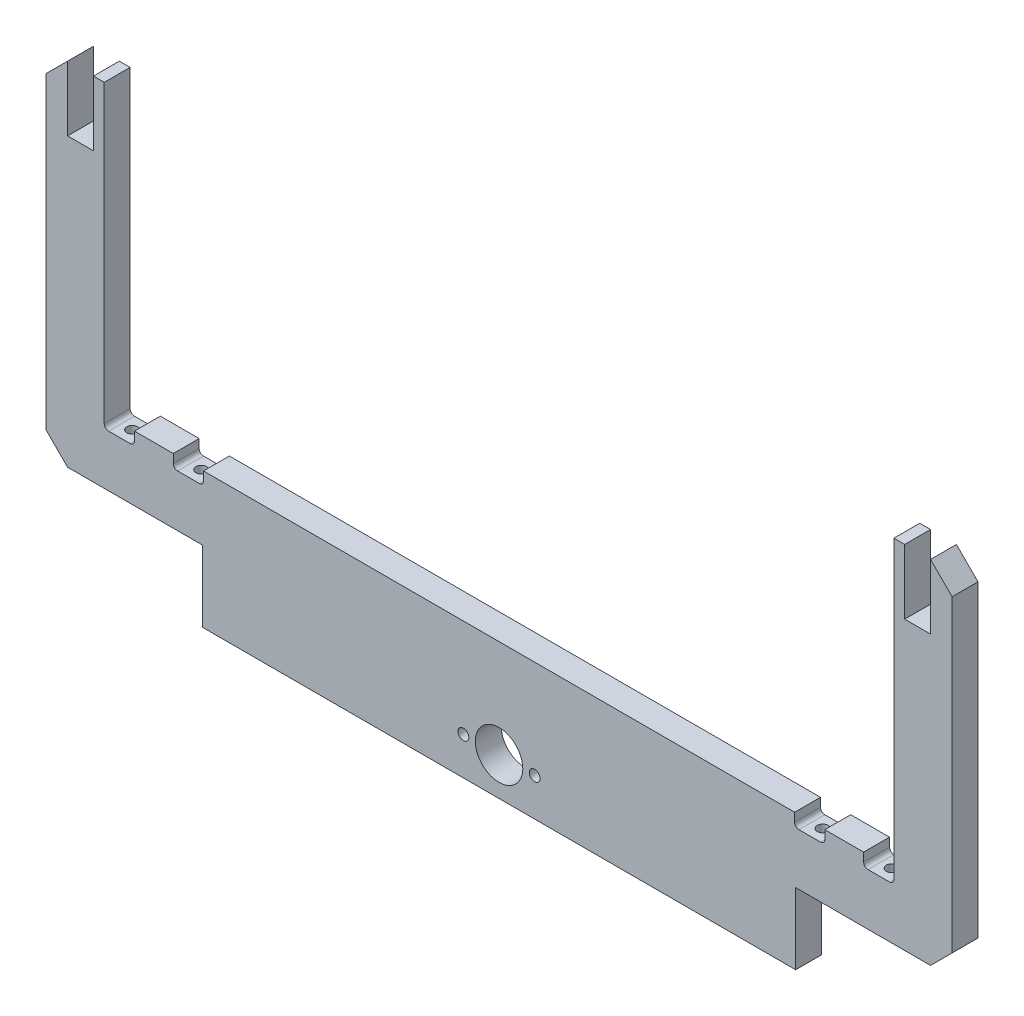
from build123d import *

# Parameters (mm, degrees)
SKETCH1_W            = 275
SKETCH1_H            = 33
BOSS_EXTRUDE1_DEPTH  = 12
CUT_EXTRUDE1_REACH   = 141.005
SKETCH2_R            = 11
SKETCH2_R_2          = 2.5
BOSS_EXTRUDE2_DEPTH  = 12
CUT_EXTRUDE2_REACH   = 250.863
SKETCH4_R            = 2.5
CUT_EXTRUDE3_REACH   = 278.522
SKETCH5_W            = 14
SKETCH5_H            = 6
FILLET1_R            = 2
FILLET1_OF_MIRROR2_R = 2
CHAMFER1_SIZE        = 10
CUT_EXTRUDE4_REACH   = 278.522
SKETCH6_W            = 12
SKETCH6_H            = 30
CHAMFER2_SIZE        = 10


with BuildPart() as part:
    # Sketch1 → Boss-Extrude1 (new body)
    with BuildSketch(Plane.XY):
        Rectangle(SKETCH1_W, SKETCH1_H)
    extrude(amount=BOSS_EXTRUDE1_DEPTH)

    # Sketch2 → Cut-Extrude1 (cut, up to next)
    with BuildSketch(Plane.XY.offset(12), mode=Mode.PRIVATE) as cut_extrude1_sk1:
        with Locations((0, 1)):
            Circle(SKETCH2_R)
    cut_extrude1_tool1 = extrude(cut_extrude1_sk1.sketch, amount=-CUT_EXTRUDE1_REACH, mode=Mode.PRIVATE) & part.part
    # Sketch2 → Cut-Extrude1 (cut, up to next)
    with BuildSketch(Plane.XY.offset(12), mode=Mode.PRIVATE) as cut_extrude1_sk2:
        with Locations((-16.5, 1)):
            Circle(SKETCH2_R_2)
    cut_extrude1_tool2 = extrude(cut_extrude1_sk2.sketch, amount=-CUT_EXTRUDE1_REACH, mode=Mode.PRIVATE) & part.part
    # Sketch2 → Cut-Extrude1 (cut, up to next)
    with BuildSketch(Plane.XY.offset(12), mode=Mode.PRIVATE) as cut_extrude1_sk3:
        with Locations((16.5, 1)):
            Circle(SKETCH2_R_2)
    cut_extrude1_tool3 = extrude(cut_extrude1_sk3.sketch, amount=-CUT_EXTRUDE1_REACH, mode=Mode.PRIVATE) & part.part
    add(cut_extrude1_tool1.solids().sort_by_distance((0, 1, 12))[0], mode=Mode.SUBTRACT)
    add(cut_extrude1_tool2.solids().sort_by_distance((-16.5, 1, 12))[0], mode=Mode.SUBTRACT)
    add(cut_extrude1_tool3.solids().sort_by_distance((16.5, 1, 12))[0], mode=Mode.SUBTRACT)

    # Sketch3 → Boss-Extrude2 (add)
    with BuildSketch(Plane.XY.offset(12)):
        Polygon((-210, 16.5), (210, 16.5), (210, 179.5), (183, 179.5), (183, 46.5), (-183, 46.5), (-183, 179.5), (-210, 179.5), align=None)
    extrude(amount=-BOSS_EXTRUDE2_DEPTH)

    # Sketch4 → Cut-Extrude2 (cut, up to next)
    with BuildSketch(Plane(origin=(0, 46.5, 0), x_dir=(1, 0, 0), z_dir=(0, 1, 0)), mode=Mode.PRIVATE) as cut_extrude2_sk1:
        with Locations(Location((-144, -6, 0), (0, 0, 270))):
            Circle(SKETCH4_R)
    cut_extrude2_tool1 = extrude(cut_extrude2_sk1.sketch, amount=-CUT_EXTRUDE2_REACH, mode=Mode.PRIVATE) & part.part
    # Sketch4 → Cut-Extrude2 (cut, up to next)
    with BuildSketch(Plane(origin=(0, 46.5, 0), x_dir=(1, 0, 0), z_dir=(0, 1, 0)), mode=Mode.PRIVATE) as cut_extrude2_sk2:
        with Locations(Location((-176, -6, 0), (0, 0, 270))):
            Circle(SKETCH4_R)
    cut_extrude2_tool2 = extrude(cut_extrude2_sk2.sketch, amount=-CUT_EXTRUDE2_REACH, mode=Mode.PRIVATE) & part.part
    cut_extrude2_1 = cut_extrude2_tool1.solids().sort_by_distance((-144, 46.5, 6))[0]
    add(cut_extrude2_1, mode=Mode.SUBTRACT)
    cut_extrude2_2 = cut_extrude2_tool2.solids().sort_by_distance((-176, 46.5, 6))[0]
    add(cut_extrude2_2, mode=Mode.SUBTRACT)
    cut_extrude2 = cut_extrude2_1 + cut_extrude2_2  # Cut-Extrude2 as one shape, for the pattern or mirror that repeats it

    # Mirror1: Cut-Extrude2 across plane
    add(cut_extrude2.mirror(Plane(origin=(0, 0, 0), x_dir=(0, 0, 1), z_dir=(1, 0, 0))), mode=Mode.SUBTRACT)

    # Sketch5 → Cut-Extrude3 (cut, up to next)
    with BuildSketch(Plane.XY.offset(12), mode=Mode.PRIVATE) as cut_extrude3_sk1:
        with Locations((-176, 43.5)):
            Rectangle(SKETCH5_W, SKETCH5_H)
    cut_extrude3_tool1 = extrude(cut_extrude3_sk1.sketch, amount=-CUT_EXTRUDE3_REACH, mode=Mode.PRIVATE) & part.part
    # Sketch5 → Cut-Extrude3 (cut, up to next)
    with BuildSketch(Plane.XY.offset(12), mode=Mode.PRIVATE) as cut_extrude3_sk2:
        with Locations((-144, 43.5)):
            Rectangle(SKETCH5_W, SKETCH5_H)
    cut_extrude3_tool2 = extrude(cut_extrude3_sk2.sketch, amount=-CUT_EXTRUDE3_REACH, mode=Mode.PRIVATE) & part.part
    cut_extrude3_1 = cut_extrude3_tool1.solids().sort_by_distance((-176, 43.5, 12))[0]
    add(cut_extrude3_1, mode=Mode.SUBTRACT)
    cut_extrude3_2 = cut_extrude3_tool2.solids().sort_by_distance((-144, 43.5, 12))[0]
    add(cut_extrude3_2, mode=Mode.SUBTRACT)
    cut_extrude3 = cut_extrude3_1 + cut_extrude3_2  # Cut-Extrude3 as one shape, for the pattern or mirror that repeats it

    # Fillet1
    fillet1_edges = [part.edges().sort_by_distance(p)[0] for p in [
        (-169, 40.5, 6),
        (-183, 40.5, 6),
        (-137, 40.5, 6),
        (-151, 40.5, 6),
    ]]
    fillet(fillet1_edges, radius=FILLET1_R)

    # Mirror2: Cut-Extrude3 across plane
    add(cut_extrude3.mirror(Plane(origin=(0, 0, 0), x_dir=(0, 0, 1), z_dir=(1, 0, 0))), mode=Mode.SUBTRACT)

    # Fillet1 of Mirror2
    fillet1_of_mirror2_edges = [part.edges().sort_by_distance(p)[0] for p in [
        (169, 40.5, 6),
        (183, 40.5, 6),
        (137, 40.5, 6),
        (151, 40.5, 6),
    ]]
    fillet(fillet1_of_mirror2_edges, radius=FILLET1_OF_MIRROR2_R)

    # Chamfer1
    chamfer1_edges = [part.edges().sort_by_distance(p)[0] for p in [
        (210, 16.5, 6),
        (-210, 16.5, 6),
    ]]
    chamfer(chamfer1_edges, length=CHAMFER1_SIZE)

    # Sketch6 → Cut-Extrude4 (cut, up to next)
    with BuildSketch(Plane.XY.offset(12), mode=Mode.PRIVATE) as cut_extrude4_sk1:
        with Locations((-194, 164.5)):
            Rectangle(SKETCH6_W, SKETCH6_H)
    cut_extrude4_tool1 = extrude(cut_extrude4_sk1.sketch, amount=-CUT_EXTRUDE4_REACH, mode=Mode.PRIVATE) & part.part
    cut_extrude4 = cut_extrude4_tool1.solids().sort_by_distance((-194, 164.5, 12))[0]
    add(cut_extrude4, mode=Mode.SUBTRACT)

    # Mirror3: Cut-Extrude4 across plane
    add(cut_extrude4.mirror(Plane(origin=(0, 0, 0), x_dir=(0, 0, 1), z_dir=(1, 0, 0))), mode=Mode.SUBTRACT)

    # Chamfer2
    chamfer2_edges = [part.edges().sort_by_distance(p)[0] for p in [
        (210, 179.5, 6),
        (-210, 179.5, 6),
    ]]
    chamfer(chamfer2_edges, length=CHAMFER2_SIZE - 0.0001)  # a hair under: the kernel refuses the full size


solid = part.part
